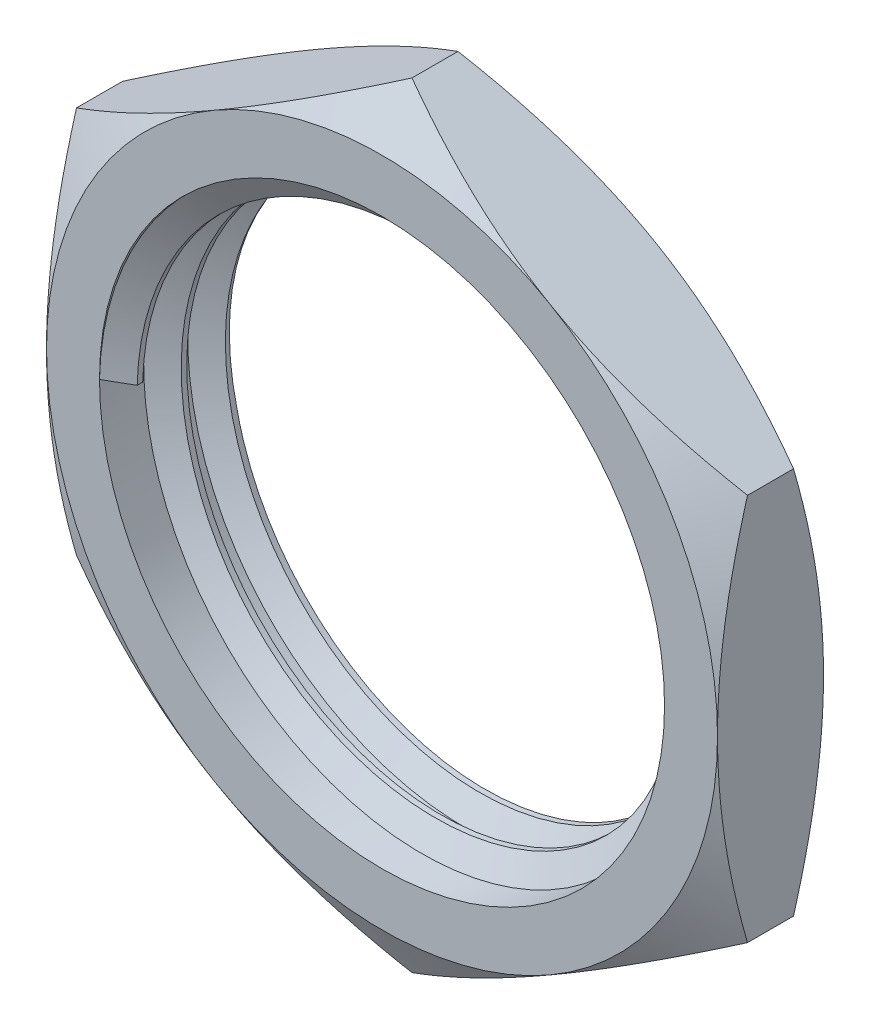
from build123d import *

# Parameters (mm, degrees)
SKETCH2_R           = 8
BOSS_EXTRUDE1_DEPTH = 3
SKETCH3_OUTSIDE_W   = 37.228
SKETCH3_OUTSIDE_H   = 40.168
SKETCH3_OUTSIDE_R   = 9.5
CUT_EXTRUDE1_DEPTH  = 3
CUT_EXTRUDE1_DRAFT  = -60
SKETCH4_OUTSIDE_W   = 37.228
SKETCH4_OUTSIDE_H   = 40.168
SKETCH4_OUTSIDE_R   = 9.5
CUT_EXTRUDE2_DEPTH  = 3
CUT_EXTRUDE2_DRAFT  = -60
THREAD1_PITCH       = 1.25
THREAD1_TO          = 3


with BuildPart() as part:
    # Sketch2 → Boss-Extrude1 (new body)
    with BuildSketch(Plane.XY):
        Polygon((0, 10.969655115), (-9.5, 5.484827557), (-9.5, -5.484827557), (0, -10.969655115), (9.5, -5.484827557), (9.5, 5.484827557), align=None)
        Circle(SKETCH2_R, mode=Mode.SUBTRACT)
    extrude(amount=BOSS_EXTRUDE1_DEPTH)


with BuildPart() as cut_extrude1_tool:
    # Sketch3 outside → Cut-Extrude1 (with draft: the straight prism first)
    with BuildSketch(Plane.XY.offset(3)):
        Rectangle(SKETCH3_OUTSIDE_W, SKETCH3_OUTSIDE_H)
        Circle(SKETCH3_OUTSIDE_R, mode=Mode.SUBTRACT)
    extrude(amount=-CUT_EXTRUDE1_DEPTH)
    # Cut-Extrude1: the draft: its side faces are tilted about the plane it starts from
    cut_extrude1_sides = [cut_extrude1_tool.faces().sort_by_distance(p)[0] for p in [
        (0, -20.084, 1.5),
        (18.614, 0, 1.5),
        (0, 20.084, 1.5),
        (-18.614, 0, 1.5),
        (-9.5, 0, 1.5),
    ]]
    draft(cut_extrude1_sides, Plane.XY.offset(3), CUT_EXTRUDE1_DRAFT)


with BuildPart() as part_1:
    add(part.part)

    # Cut-Extrude1: cut by cut_extrude1_tool
    add(cut_extrude1_tool.part, mode=Mode.SUBTRACT)


with BuildPart() as cut_extrude2_tool:
    # Sketch4 outside → Cut-Extrude2 (with draft: the straight prism first)
    with BuildSketch(Plane(origin=(0, 0, 0), x_dir=(-1, 0, 0), z_dir=(0, 0, -1))):
        Rectangle(SKETCH4_OUTSIDE_W, SKETCH4_OUTSIDE_H)
        Circle(SKETCH4_OUTSIDE_R, mode=Mode.SUBTRACT)
    extrude(amount=-CUT_EXTRUDE2_DEPTH)
    # Cut-Extrude2: the draft: its side faces are tilted about the plane it starts from
    cut_extrude2_sides = [cut_extrude2_tool.faces().sort_by_distance(p)[0] for p in [
        (0, -20.084, 1.5),
        (-18.614, 0, 1.5),
        (0, 20.084, 1.5),
        (18.614, 0, 1.5),
        (9.5, 0, 1.5),
    ]]
    draft(cut_extrude2_sides, Plane(origin=(0, 0, 0), x_dir=(-1, 0, 0), z_dir=(0, 0, -1)), CUT_EXTRUDE2_DRAFT)


with BuildPart() as part_2:
    add(part_1.part)

    # Cut-Extrude2: cut by cut_extrude2_tool
    add(cut_extrude2_tool.part, mode=Mode.SUBTRACT)

    # Thread1: arcs per turn and ends read off the stored shape
    # Thread1: the profile of Thread Profile1 profile screwed along a right-hand helix through 3.2 turns, 8 arcs to a turn; built about Z, then put on its axis
    thread1_z = Axis((0, 0, 0), (0, 0, 1))
    thread1_corners = [(8.0003, 0, -0.000173205), (7.323417656, 0, 0.390624998), (7.323417656, 0, 0.546874998), (8.0003, 0, 0.937673202)]
    with BuildLine(mode=Mode.PRIVATE) as thread1_profile:
        Line(thread1_corners[0], thread1_corners[1])
        Line(thread1_corners[1], thread1_corners[2])
        Line(thread1_corners[2], thread1_corners[3])
        Line(thread1_corners[3], thread1_corners[0])
    thread1_cap = Face(thread1_profile.wire())
    thread1_turn_angles = [0, 22.5, 45, 67.5, 90, 112.5, 135, 157.5, 180, 202.5, 225, 247.5, 270, 292.5, 315, 337.5, 360]
    thread1_turn_weights = [1, 0.9238795325112867, 1, 0.9238795325112867, 1, 0.9238795325112867, 1, 0.9238795325112867, 1, 0.9238795325112867, 1, 0.9238795325112867, 1, 0.9238795325112867, 1, 0.9238795325112867, 1]
    thread1_turn_rails = [Edge.make_bspline([Vector(p[0], p[1], 0).rotate(thread1_z, thread1_turn_angles[k]) / thread1_turn_weights[k] + Vector(0, 0, p[2] + THREAD1_PITCH * thread1_turn_angles[k] / 360) for k in range(17)], [0, 0, 0, 1, 1, 2, 2, 3, 3, 4, 4, 5, 5, 6, 6, 7, 7, 8, 8, 8], 2, thread1_turn_weights) for p in thread1_corners]
    thread1_turn_sides = [Face.make_surface_from_curves(thread1_turn_rails[p[0]], thread1_turn_rails[p[1]]) for p in [(0, 1), (1, 2), (2, 3), (3, 0)]]
    thread1_last_angles = [1080, 1102.5, 1125, 1138.5, 1152]
    thread1_last_weights = [1, 0.9238795325112867, 1, 0.9723699203976766, 1]
    thread1_last_rails = [Edge.make_bspline([Vector(p[0], p[1], 0).rotate(thread1_z, thread1_last_angles[k]) / thread1_last_weights[k] + Vector(0, 0, p[2] + THREAD1_PITCH * thread1_last_angles[k] / 360) for k in range(5)], [0, 0, 0, 1, 1, 2, 2, 2], 2, thread1_last_weights) for p in thread1_corners]
    thread1_last_sides = [Face.make_surface_from_curves(thread1_last_rails[p[0]], thread1_last_rails[p[1]]) for p in [(0, 1), (1, 2), (2, 3), (3, 0)]]
    thread1 = Plane(origin=(0, 0, 3), x_dir=(-1, 0, 0), z_dir=(0, 0, -1)) * split(Solid(Shell([*[p.moved(Location((0, 0, THREAD1_PITCH * i))) for i in range(3) for p in thread1_turn_sides], *thread1_last_sides, thread1_cap, thread1_cap.rotate(thread1_z, 1152).moved(Location((0, 0, THREAD1_PITCH * 1152 / 360)))])), bisect_by=Plane.XY.offset(THREAD1_TO), keep=Keep.BOTTOM, mode=Mode.PRIVATE)
    add(thread1)


solid = part_2.part
